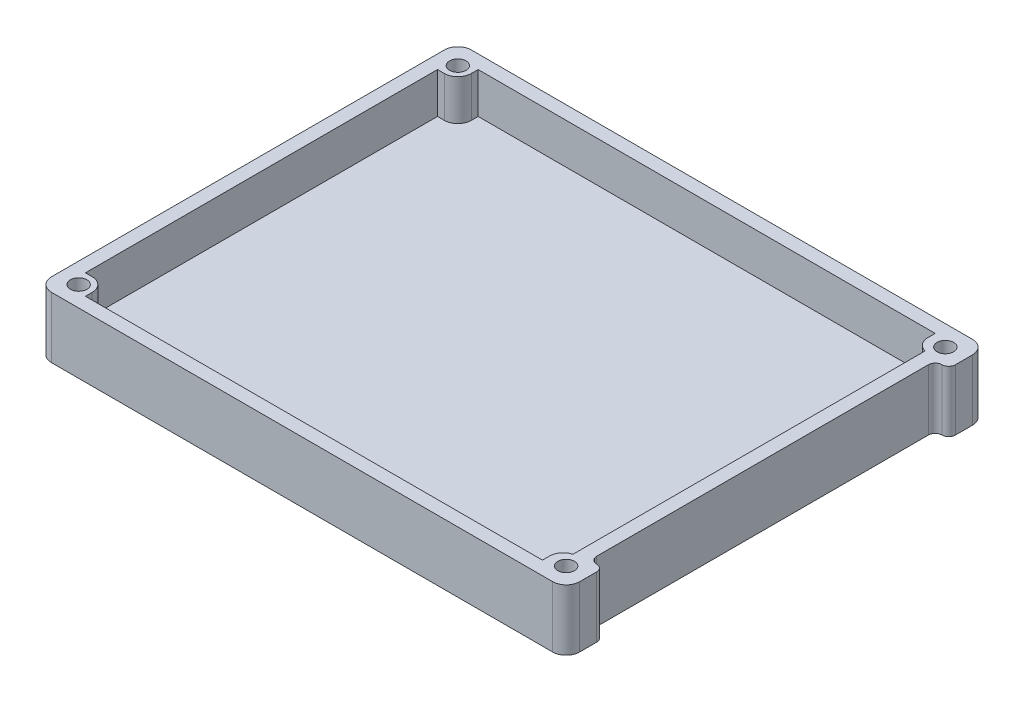
from build123d import *

# Parameters (mm, degrees)
BOSS_EXTRUDE2_DEPTH                               = 3
BOSS_EXTRUDE3_DEPTH                               = 6
FILLET5_R                                         = 2
CSK_FOR_2_FLAT_HEAD_SOCKET_CAP_SCREW1_D           = 2.4384
CSK_FOR_2_FLAT_HEAD_SOCKET_CAP_SCREW1_CSINK_D     = 5.0038
CSK_FOR_2_FLAT_HEAD_SOCKET_CAP_SCREW1_CSINK_ANGLE = 82
FILLET6_R                                         = 2
FILLET7_R                                         = 1


# Some blends are built 0.0001 mm under size
with BuildPart() as part:
    # Sketch3 → Boss-Extrude2 (new body)
    with BuildSketch(Plane.XZ):
        Polygon((-37.5, 31), (40.5, 31), (40.5, 25.5), (38.5, 25.5), (38.5, -25.5), (40.5, -25.5), (40.5, -31), (-37.5, -31), align=None)
    extrude(amount=BOSS_EXTRUDE2_DEPTH)

    # Sketch4 → Boss-Extrude3 (add)
    with BuildSketch(Plane(origin=(0, 0, 0), x_dir=(1, 0, 0), z_dir=(0, 1, 0))):
        Polygon((-37.5, -31), (40.5, -31), (40.5, -25.5), (38.5, -25.5), (38.5, 25.5), (40.5, 25.5), (40.5, 31), (-37.5, 31), align=None)
        Polygon((-32.5, -29), (35, -29), (35, -26), (36.5, -26), (36.5, 26), (35, 26), (35, 29), (-32.5, 29), (-32.5, 26), (-35.5, 26), (-35.5, -26), (-32.5, -26), align=None, mode=Mode.SUBTRACT)
    extrude(amount=BOSS_EXTRUDE3_DEPTH)

    # Fillet5
    # the kernel refuses this fillet: 2 mm, written as the material it takes off along each edge
    with BuildSketch(Plane(origin=(35, 0, 26), x_dir=(0, 0, 1), z_dir=(0, 1, 0))) as fillet5_piece_1:
        with BuildLine():
            CenterArc((1.936491673, 2), FILLET5_R, 194.477512186, 75.522487814)
            Line((0, 1.5), (-0.038729833, 1.49))
            ThreePointArc((-0.038729833, 1.49), (-0.04, 0.75), (-0.04, 0))
            Line((-0.04, 0), (0, -0.04))
            Line((0, -0.04), (1.936491673, -0.04))
            Line((1.936491673, -0.04), (1.936491673, 0))
        make_face()
    extrude(amount=10.841229183, mode=Mode.SUBTRACT)
    with BuildSketch(Plane(origin=(35, 0, -26), x_dir=(1, 0, 0), z_dir=(0, 1, 0))) as fillet5_piece_2:
        with BuildLine():
            CenterArc((2, 1.936491673), FILLET5_R, 180, 75.522487814)
            Line((0, 1.936491673), (-0.04, 1.936491673))
            Line((-0.04, 1.936491673), (-0.04, 0))
            Line((-0.04, 0), (0, -0.04))
            ThreePointArc((0, -0.04), (0.75, -0.04), (1.49, -0.038729833))
            Line((1.49, -0.038729833), (1.5, 0))
        make_face()
    extrude(amount=10.841229183, mode=Mode.SUBTRACT)
    with BuildSketch(Plane(origin=(-32.5, 0, -26), x_dir=(0, 0, -1), z_dir=(0, 1, 0)), Plane(origin=(-32.5, 0, 26), x_dir=(-1, 0, 0), z_dir=(0, 1, 0))) as fillet5_piece_3:
        with BuildLine():
            CenterArc((FILLET5_R, FILLET5_R), FILLET5_R, 180, 90)
            Line((0, FILLET5_R), (-FILLET5_R * 0.02, FILLET5_R))
            Line((-FILLET5_R * 0.02, FILLET5_R), (-FILLET5_R * 0.02, -FILLET5_R * 0.02))
            Line((-FILLET5_R * 0.02, -FILLET5_R * 0.02), (FILLET5_R, -FILLET5_R * 0.02))
            Line((FILLET5_R, -FILLET5_R * 0.02), (FILLET5_R, 0))
        make_face()
    extrude(amount=11, mode=Mode.SUBTRACT)

    # CSK for #2 Flat Head Socket Cap Screw1 (through all)
    with Locations(Plane(origin=(0, -3, 0), x_dir=(-1, 0, 0), z_dir=(0, -1, 0))):
        with Locations((-37.5, 28), (34.5, 28), (34.5, -28), (-37.5, -28)):
            CounterSinkHole(CSK_FOR_2_FLAT_HEAD_SOCKET_CAP_SCREW1_D / 2, CSK_FOR_2_FLAT_HEAD_SOCKET_CAP_SCREW1_CSINK_D / 2, counter_sink_angle=CSK_FOR_2_FLAT_HEAD_SOCKET_CAP_SCREW1_CSINK_ANGLE)

    # Fillet6
    fillet6_edges = [part.edges().sort_by_distance(p)[0] for p in [
        (40.5, 1.5, -31),
        (-37.5, 1.5, -31),
        (-37.5, 1.5, 31),
        (40.5, 1.5, 31),
    ]]
    fillet(fillet6_edges, radius=FILLET6_R)

    # Fillet7
    fillet7_edges = [part.edges().sort_by_distance(p)[0] for p in [
        (38.5, 1.5, -25.5),
        (38.5, 1.5, 25.5),
    ]]
    fillet(fillet7_edges, radius=FILLET7_R)
    fillet7_2_edges = [part.edges().sort_by_distance(p)[0] for p in [
        (40.5, 1.5, -25.5),
        (40.5, 1.5, 25.5),
    ]]
    fillet(fillet7_2_edges, radius=FILLET7_R - 0.0001)  # a hair under: the kernel refuses the full size


solid = part.part
